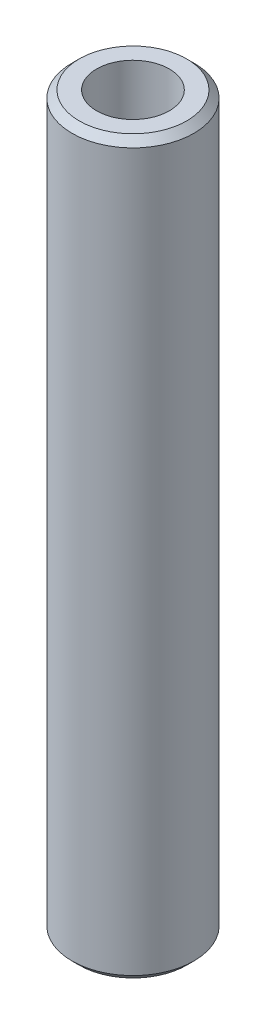
from build123d import *

# Parameters (mm, degrees)
SKETCH1_R           = 50
BOSS_EXTRUDE1_DEPTH = 600
SKETCH2_R           = 29.825367563
CUT_EXTRUDE1_DEPTH  = 605.15229868
CHAMFER1_SIZE       = 5.883127089


with BuildPart() as part:
    # Sketch1 → Boss-Extrude1 (new body)
    with BuildSketch(Plane(origin=(0, 0, 0), x_dir=(1, 0, 0), z_dir=(0, 1, 0))):
        Circle(SKETCH1_R)
    extrude(amount=BOSS_EXTRUDE1_DEPTH)

    # Sketch2 → Cut-Extrude1 (cut, through all)
    with BuildSketch(Plane(origin=(0, 0, 0), x_dir=(1, 0, 0), z_dir=(0, 1, 0))):
        Circle(SKETCH2_R)
    extrude(amount=CUT_EXTRUDE1_DEPTH, mode=Mode.SUBTRACT)

    # Chamfer1
    chamfer1_edges = [part.edges().sort_by_distance(p)[0] for p in [
        (-50, 600, 0),
        (-50, 0, 0),
    ]]
    chamfer(chamfer1_edges, length=CHAMFER1_SIZE)


solid = part.part
